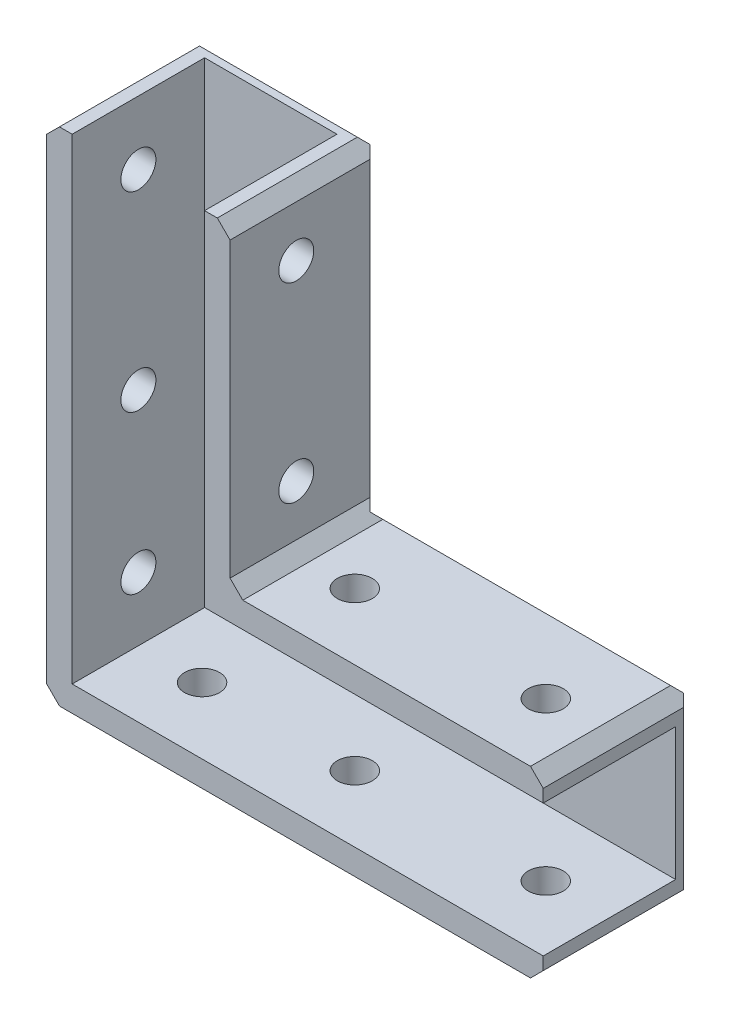
from build123d import *

# Parameters (mm, degrees)
ESQUISSE2_W             = 28.8
ESQUISSE2_H             = 50
ESQUISSE2_W_2           = 78
ESQUISSE2_H_2           = 28.8
BOSS_EXTRU_2_DEPTH      = 24
ENL_V_MAT_EXTRU_1_DEPTH = 20.8
ESQUISSE4_R             = 2.75
ENL_V_MAT_EXTRU_2_DEPTH = 31.389271111
ESQUISSE5_R             = 2.75
ENL_V_MAT_EXTRU_3_DEPTH = 31.389271111
ESQUISSE6_R             = 2.75
ENL_V_MAT_EXTRU_4_DEPTH = 31.389271111
ESQUISSE7_R             = 2.75
ENL_V_MAT_EXTRU_5_DEPTH = 31.389271111
CHANFREIN1_SIZE         = 2
CHANFREIN2_SIZE         = 2


with BuildPart() as part:
    # Esquisse2 → Boss.-Extru.2 (new body)
    with BuildSketch(Plane.XY):
        with Locations((14.4, 53.8)):
            Rectangle(ESQUISSE2_W, ESQUISSE2_H)
        with Locations((39, 14.4)):
            Rectangle(ESQUISSE2_W_2, ESQUISSE2_H_2)
    extrude(amount=BOSS_EXTRU_2_DEPTH)

    # Esquisse3 → Enlèv. mat.-Extru.1 (cut)
    with BuildSketch(Plane.XY.offset(24)):
        Polygon((4, 78.8), (4, 4), (78, 4), (78, 24.8), (24.8, 24.8), (24.8, 78.8), align=None)
    extrude(amount=-ENL_V_MAT_EXTRU_1_DEPTH, mode=Mode.SUBTRACT)

    # Esquisse4 → Enlèv. mat.-Extru.2 (cut)
    with BuildSketch(Plane(origin=(0, 28.8, 0), x_dir=(1, 0, 0), z_dir=(0, 1, 0))):
        with Locations(Location((68, -13.6, 0), (0, 0, 270))):
            Circle(ESQUISSE4_R)
        with Locations(Location((38, -13.6, 0), (0, 0, 270))):
            Circle(ESQUISSE4_R)
    extrude(amount=-ENL_V_MAT_EXTRU_2_DEPTH, mode=Mode.SUBTRACT)

    # Esquisse5 → Enlèv. mat.-Extru.3 (cut)
    with BuildSketch(Plane(origin=(28.8, 0, 0), x_dir=(0, 0, -1), z_dir=(1, 0, 0))):
        with Locations(Location((-13.6, 38.8, 0), (0, 0, 270))):
            Circle(ESQUISSE5_R)
        with Locations(Location((-13.6, 68.8, 0), (0, 0, 270))):
            Circle(ESQUISSE5_R)
    extrude(amount=-ENL_V_MAT_EXTRU_3_DEPTH, mode=Mode.SUBTRACT)

    # Esquisse6 → Enlèv. mat.-Extru.4 (cut)
    with BuildSketch(Plane.ZY):
        with Locations((13.6, 14)):
            Circle(ESQUISSE6_R)
    extrude(amount=-ENL_V_MAT_EXTRU_4_DEPTH, mode=Mode.SUBTRACT)

    # Esquisse7 → Enlèv. mat.-Extru.5 (cut)
    with BuildSketch(Plane.XZ):
        with Locations(Location((14, 13.6, 0), (0, 0, 270))):
            Circle(ESQUISSE7_R)
    extrude(amount=-ENL_V_MAT_EXTRU_5_DEPTH, mode=Mode.SUBTRACT)

    # Chanfrein1
    chanfrein1_edges = [part.edges().sort_by_distance(p)[0] for p in [
        (28.8, 53.8, 0),
        (53.4, 28.8, 0),
        (39, 0, 0),
        (0, 39.4, 0),
    ]]
    chamfer(chanfrein1_edges, length=CHANFREIN1_SIZE)

    # Chanfrein2
    # the kernel refuses this chamfer: 2 mm, written as the material it adds along each edge
    with BuildSketch(Plane(origin=(28.8, 28.8, -3.143365976), x_dir=(-0.027495876610585647, 0.9996219169112968, 0), z_dir=(0, 0, 1))) as chanfrein2_piece_1_section:
        Polygon((CHANFREIN2_SIZE * 0.999621916911, -CHANFREIN2_SIZE * 0.0274958766106), (-CHANFREIN2_SIZE * 0.0274958766106, -CHANFREIN2_SIZE * 0.999621916911), (0, 0), align=None)
    chanfrein2_piece_1 = extrude(amount=27.143365976, mode=Mode.PRIVATE)
    chanfrein2_piece_1 = split(chanfrein2_piece_1, bisect_by=Plane(origin=(29.819330427, 29.005558504, 3.019330427), z_dir=(0.7071067811865476, 0, -0.7071067811865476)), keep=Keep.TOP, mode=Mode.PRIVATE)
    chanfrein2_piece_1 = split(chanfrein2_piece_1, bisect_by=Plane(origin=(30.090587735, 29.276815812, 2.476815812), z_dir=(0, -0.7071067811865476, 0.7071067811865476)), keep=Keep.TOP, mode=Mode.PRIVATE)
    add(chanfrein2_piece_1)
    with BuildSketch(Plane(origin=(28.8, 28.8, -3.143365976), x_dir=(-0.027495876610585647, 0.9996219169112968, 0), z_dir=(0, 0, 1))) as chanfrein2_piece_2_section:
        Polygon((CHANFREIN2_SIZE * 0.999621916911, -CHANFREIN2_SIZE * 0.0274958766106), (-CHANFREIN2_SIZE * 0.0274958766106, -CHANFREIN2_SIZE * 0.999621916911), (0, 0), align=None)
    chanfrein2_piece_2 = extrude(amount=27.143365976, mode=Mode.PRIVATE)
    chanfrein2_piece_2 = split(chanfrein2_piece_2, bisect_by=Plane(origin=(29.276815812, 30.090587735, 2.476815812), z_dir=(-0.7071067811865476, 0, 0.7071067811865476)), keep=Keep.TOP, mode=Mode.PRIVATE)
    chanfrein2_piece_2 = split(chanfrein2_piece_2, bisect_by=Plane(origin=(29.005558504, 29.819330427, 3.019330427), z_dir=(0, 0.7071067811865476, -0.7071067811865476)), keep=Keep.TOP, mode=Mode.PRIVATE)
    add(chanfrein2_piece_2)
    with BuildSketch(Plane(origin=(28.8, 28.8, -3.143365976), x_dir=(-0.027495876610585647, 0.9996219169112968, 0), z_dir=(0, 0, 1))) as chanfrein2_piece_3_section:
        Polygon((CHANFREIN2_SIZE * 0.999621916911, -CHANFREIN2_SIZE * 0.0274958766106), (-CHANFREIN2_SIZE * 0.0274958766106, -CHANFREIN2_SIZE * 0.999621916911), (0, 0), align=None)
    chanfrein2_piece_3 = extrude(amount=27.143365976, mode=Mode.PRIVATE)
    chanfrein2_piece_3 = split(chanfrein2_piece_3, bisect_by=Plane(origin=(34.880092378, 29.455254944, 8.080092378), z_dir=(-0.7071067811865476, 0, 0.7071067811865476)), keep=Keep.TOP, mode=Mode.PRIVATE)
    chanfrein2_piece_3 = split(chanfrein2_piece_3, bisect_by=Plane(origin=(29.455254944, 34.880092378, 8.080092378), z_dir=(0, -0.7071067811865476, 0.7071067811865476)), keep=Keep.TOP, mode=Mode.PRIVATE)
    add(chanfrein2_piece_3)
    # the kernel refuses this chamfer: 2 mm, written as the material it takes off along each edge
    with BuildSketch(Plane(origin=(0, 0, -3.143365976), x_dir=(-0.027495876610586372, 0.9996219169112968, 0), z_dir=(0, 0, 1)), Plane(origin=(28.8, 78.8, -3.143365976), x_dir=(0.02749587661058555, -0.9996219169112968, 0), z_dir=(0, 0, 1)), Plane(origin=(78, 28.8, -3.143365976), x_dir=(0.0274958766105891, -0.9996219169112968, 0), z_dir=(0, 0, 1))) as chanfrein2_2_piece_1:
        Polygon((CHANFREIN2_SIZE * 0.999621916911, -CHANFREIN2_SIZE * 0.0274958766106), (-CHANFREIN2_SIZE * 0.0274958766106, -CHANFREIN2_SIZE * 0.999621916911), (0, 0), align=None)
    extrude(amount=32.286731952, mode=Mode.SUBTRACT)
    with BuildSketch(Plane(origin=(0, 78.8, -3.143365976), x_dir=(-0.027495876610586292, -0.9996219169112968, 0), z_dir=(0, 0, 1)), Plane(origin=(78, 0, -3.143365976), x_dir=(0.02749587661058908, 0.9996219169112968, 0), z_dir=(0, 0, 1))) as chanfrein2_2_piece_2:
        Polygon((CHANFREIN2_SIZE * 0.999621916911, CHANFREIN2_SIZE * 0.0274958766106), (-CHANFREIN2_SIZE * 0.0274958766106, CHANFREIN2_SIZE * 0.999621916911), (0, 0), align=None)
    extrude(amount=32.286731952, mode=Mode.SUBTRACT)
    with BuildSketch(Plane(origin=(31.943365976, 78.8, 0), x_dir=(0, -0.9996219169112968, -0.027495876610586292), z_dir=(-1, 0, 0))) as chanfrein2_2_piece_3:
        Polygon((CHANFREIN2_SIZE * 0.999621916911, CHANFREIN2_SIZE * 0.0274958766106), (-CHANFREIN2_SIZE * 0.0274958766106, CHANFREIN2_SIZE * 0.999621916911), (0, 0), align=None)
    extrude(amount=35.086731952, mode=Mode.SUBTRACT)
    with BuildSketch(Plane(origin=(78, -3.143365976, 0), x_dir=(0.02749587661058908, 0, 0.9996219169112968), z_dir=(0, 1, 0))) as chanfrein2_2_piece_4:
        Polygon((CHANFREIN2_SIZE * 0.999621916911, -CHANFREIN2_SIZE * 0.0274958766106), (-CHANFREIN2_SIZE * 0.0274958766106, -CHANFREIN2_SIZE * 0.999621916911), (0, 0), align=None)
    extrude(amount=35.086731952, mode=Mode.SUBTRACT)


solid = part.part
